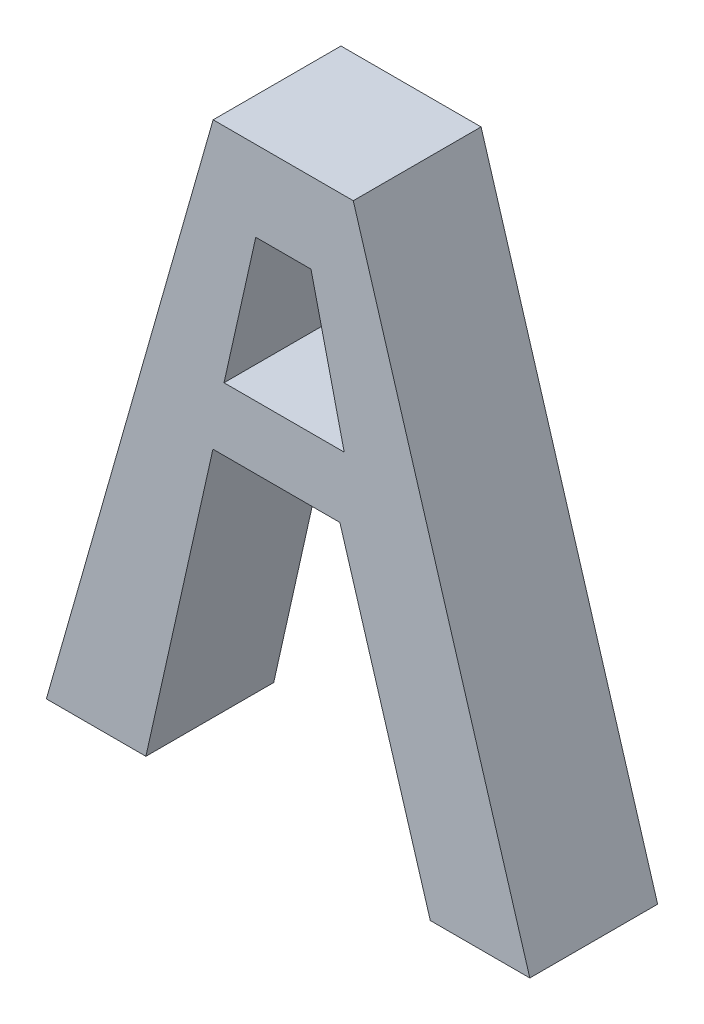
from build123d import *

# Parameters (mm, degrees)
BOSS_EXTRUDE2_DEPTH = 24.13


with BuildPart() as part:
    # Sketch6 → Boss-Extrude2 (new body)
    with BuildSketch(Plane.XY):
        Polygon((8.802012543, 61.086864225), (-17.65164723, 61.086864225), (-49.136779666, -49.333890815), (-30.34778798, -49.333890815), (-17.693848536, 7.215822009), (6.274591177, 7.215822009), (23.344747866, -49.333890815), (42.133739551, -49.333890815), align=None)
        Polygon((-15.596751758, 19.121024709), (-9.602780443, 45.907730783), (0.820143797, 45.907730783), (7.094734974, 19.121024709), align=None, mode=Mode.SUBTRACT)
    extrude(amount=BOSS_EXTRUDE2_DEPTH)


solid = part.part
